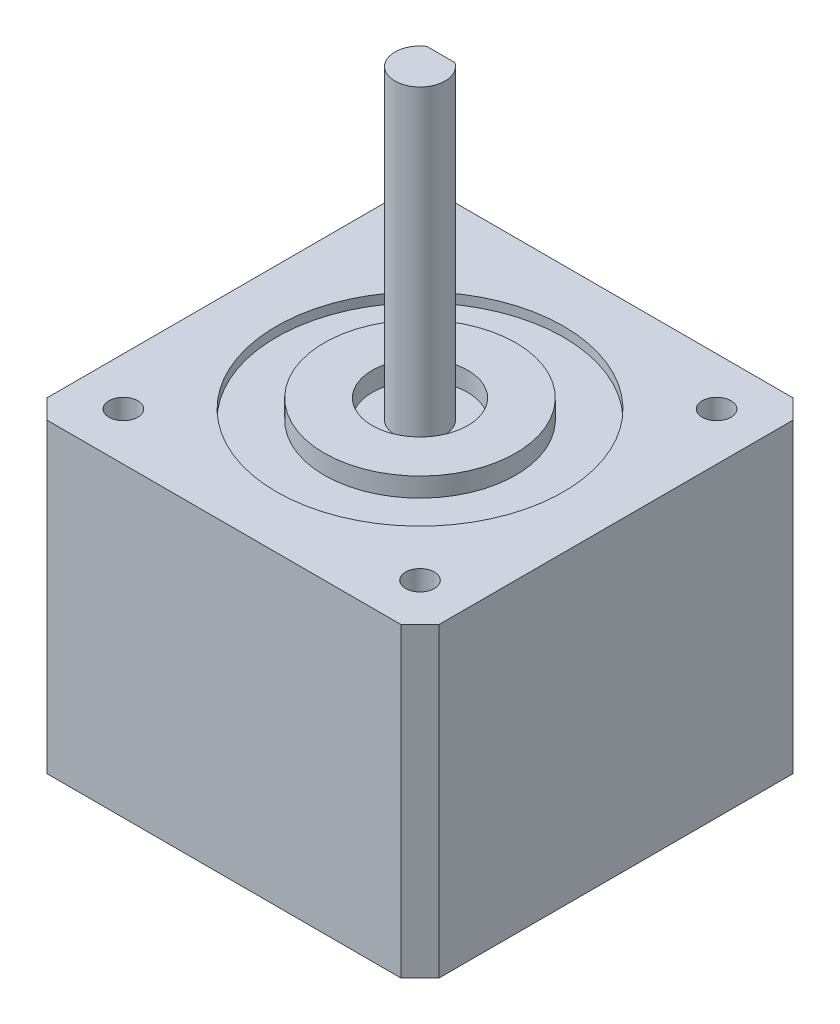
from build123d import *

# Parameters (mm, degrees)
BOSS_EXTRUDE1_DEPTH          = 32
SKETCH2_R                    = 15
CUT_EXTRUDE1_DEPTH           = 1
SKETCH3_R                    = 10
SKETCH3_R_2                  = 5
BOSS_EXTRUDE2_DEPTH          = 2
BOSS_EXTRUDE3_DEPTH          = 32
F_3_0_3_DIAMETER_HOLE1_D     = 3
F_3_0_3_DIAMETER_HOLE1_DEPTH = 5
F_3_0_3_DIAMETER_HOLE1_TIP   = 0.901290929


with BuildPart() as part:
    # Sketch1 → Boss-Extrude1 (new body)
    with BuildSketch(Plane(origin=(0, 0, 0), x_dir=(1, 0, 0), z_dir=(0, 1, 0))):
        Polygon((-20.5, 18.5), (-18.5, 20.5), (18.5, 20.5), (20.5, 18.5), (20.5, -18.5), (18.5, -20.5), (-18.5, -20.5), (-20.5, -18.5), align=None)
    extrude(amount=BOSS_EXTRUDE1_DEPTH)

    # Sketch2 → Cut-Extrude1 (cut)
    with BuildSketch(Plane(origin=(0, 32, 0), x_dir=(-1, 0, 0), z_dir=(0, 1, 0))):
        Circle(SKETCH2_R)
    extrude(amount=-CUT_EXTRUDE1_DEPTH, mode=Mode.SUBTRACT)

    # Sketch3 → Boss-Extrude2 (add)
    with BuildSketch(Plane(origin=(0, 31, 0), x_dir=(1, 0, 0), z_dir=(0, 1, 0))):
        Circle(SKETCH3_R)
        Circle(SKETCH3_R_2, mode=Mode.SUBTRACT)
    extrude(amount=BOSS_EXTRUDE2_DEPTH)

    # Sketch4 → Boss-Extrude3 (add)
    with BuildSketch(Plane(origin=(0, 31, 0), x_dir=(1, 0, 0), z_dir=(0, 1, 0))):
        with BuildLine():
            Line((-1.470984161, 2.175359116), (1.470984161, 2.175359116))
            ThreePointArc((1.470984161, 2.175359116), (0, -2.626020123), (-1.470984161, 2.175359116))
        make_face()
    extrude(amount=BOSS_EXTRUDE3_DEPTH)

    # Ø3.0 (3) Diameter Hole1
    with Locations(Plane(origin=(0, 32, 0), x_dir=(-1, 0, 0), z_dir=(0, 1, 0))):
        with Locations((-15.5, -15.5), (15.5, -15.5), (15.5, 15.5), (-15.5, 15.5)):
            Hole(F_3_0_3_DIAMETER_HOLE1_D / 2, depth=F_3_0_3_DIAMETER_HOLE1_DEPTH)
            with Locations((0, 0, -(F_3_0_3_DIAMETER_HOLE1_DEPTH + F_3_0_3_DIAMETER_HOLE1_TIP / 2))):  # 118° drill point
                Cone(0, F_3_0_3_DIAMETER_HOLE1_D / 2, F_3_0_3_DIAMETER_HOLE1_TIP, mode=Mode.SUBTRACT)


solid = part.part
